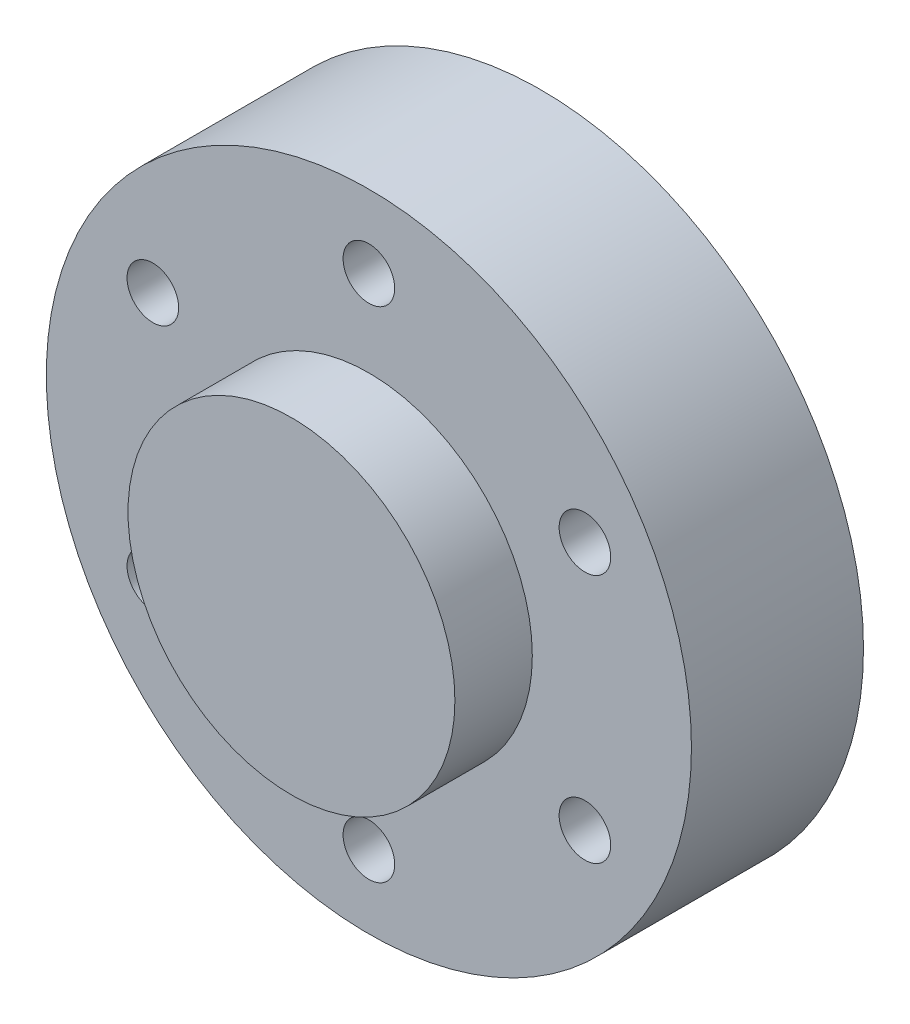
from build123d import *

# Parameters (mm, degrees)
SKETCH2_R           = 18.75
SKETCH2_R_2         = 1.5
BOSS_EXTRUDE1_DEPTH = 10
SKETCH3_R           = 9.5
BOSS_EXTRUDE2_DEPTH = 4.5
BOSS_EXTRUDE4_START = 4.5
SKETCH6_R           = 9.5
BOSS_EXTRUDE4_DEPTH = 4.5
SKETCH7_R           = 1.525
BOSS_EXTRUDE5_DEPTH = 1
FILLET2_R           = 0.05
SKETCH9_R           = 1.4
CUT_EXTRUDE1_DEPTH  = 10


with BuildPart() as part:
    # Sketch2 → Boss-Extrude1 (new body)
    with BuildSketch(Plane.XY):
        Circle(SKETCH2_R)
        with Locations((0, -14.5)):
            Circle(SKETCH2_R_2, mode=Mode.SUBTRACT)
        with Locations((-12.557368355, -7.25)):
            Circle(SKETCH2_R_2, mode=Mode.SUBTRACT)
        with Locations((12.557368355, -7.25)):
            Circle(SKETCH2_R_2, mode=Mode.SUBTRACT)
        with Locations((-12.557368355, 7.25)):
            Circle(SKETCH2_R_2, mode=Mode.SUBTRACT)
        with Locations((0, 14.5)):
            Circle(SKETCH2_R_2, mode=Mode.SUBTRACT)
        with Locations((12.557368355, 7.25)):
            Circle(SKETCH2_R_2, mode=Mode.SUBTRACT)
    extrude(amount=BOSS_EXTRUDE1_DEPTH)

    # Sketch3 → Boss-Extrude2 (add)
    with BuildSketch(Plane.XY.offset(10)):
        Circle(SKETCH3_R)
    extrude(amount=BOSS_EXTRUDE2_DEPTH)

    # Sketch6 → Boss-Extrude4 (add)
    with BuildSketch(Plane(origin=(0, 0, 0), x_dir=(-1, 0, 0), z_dir=(0, 0, -1)).offset(BOSS_EXTRUDE4_START)):
        Circle(SKETCH6_R)
    extrude(amount=-BOSS_EXTRUDE4_DEPTH)

    # Sketch7 → Boss-Extrude5 (add)
    with BuildSketch(Plane(origin=(0, 0, -4.5), x_dir=(-1, 0, 0), z_dir=(0, 0, -1))):
        Circle(SKETCH7_R)
    extrude(amount=BOSS_EXTRUDE5_DEPTH)

    # Fillet2
    fillet2_edges = [part.edges().sort_by_distance(p)[0] for p in [
        (1.525, 0, -5.5),
    ]]
    fillet(fillet2_edges, radius=FILLET2_R)

    # Sketch9 → Cut-Extrude1 (cut)
    with BuildSketch(Plane(origin=(0, 0, -5.5), x_dir=(-1, 0, 0), z_dir=(0, 0, -1))):
        Circle(SKETCH9_R)
    extrude(amount=-CUT_EXTRUDE1_DEPTH, mode=Mode.SUBTRACT)


solid = part.part
